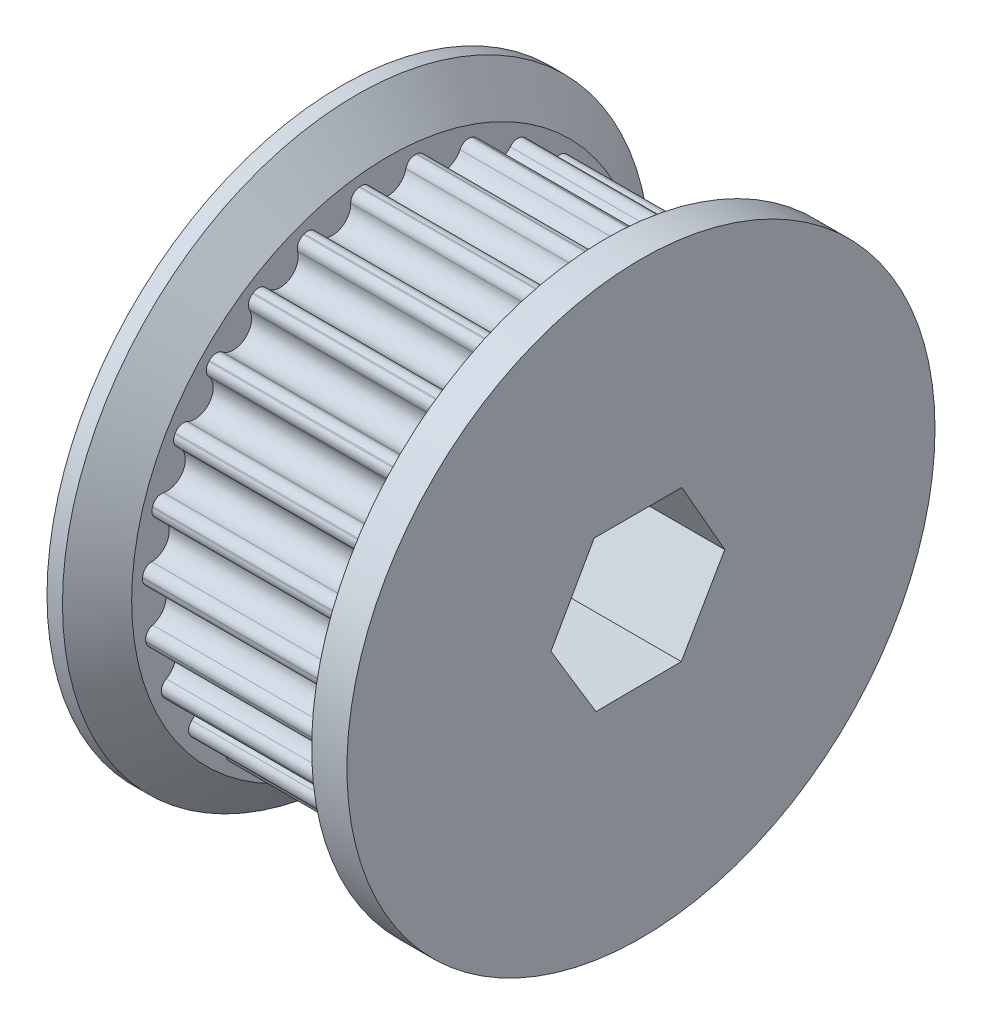
from build123d import *

# Parameters (mm, degrees)
SKETCH1_R                = 20.915
BOSS_EXTRUDE1_DEPTH      = 18.5
CUT_EXTRUDE6_START       = -43
CUT_EXTRUDE6_DEPTH       = 43
FILLET4_R                = 0.8
CIRPATTERN1_COUNT        = 27
FILLET4_OF_CIRPATTERN1_R = 0.8
SKETCH10_R               = 25
BOSS_EXTRUDE7_DEPTH      = 3
BOSS_EXTRUDE8_START      = 4
SKETCH11_R               = 25
BOSS_EXTRUDE8_DEPTH      = 4
CHAMFER1_SIZE            = 3.2
CHAMFER1_SIZE2           = 2.68511882
CUT_EXTRUDE5_DEPTH       = 42.379342793
CUT_EXTRUDE5_DEPTH_BACK  = 42.379342793


with BuildPart() as part:
    # Sketch1 → Boss-Extrude1 (new body)
    with BuildSketch(Plane(origin=(0, 0, 0), x_dir=(0, 0, -1), z_dir=(1, 0, 0))):
        Circle(SKETCH1_R)
    extrude(amount=BOSS_EXTRUDE1_DEPTH)

    # Sketch8 → Cut-Extrude6 (cut)
    with BuildSketch(Plane(origin=(18.5, 0, 0), x_dir=(0, 0, -1), z_dir=(1, 0, 0)).offset(CUT_EXTRUDE6_START)):
        with BuildLine():
            ThreePointArc((-1.488261256, 20.861982251), (0, 18.915), (1.488261256, 20.861982251))
            ThreePointArc((1.488261256, 20.861982251), (0, 20.915), (-1.488261256, 20.861982251))
        make_face()
    cut_extrude6 = extrude(amount=CUT_EXTRUDE6_DEPTH, mode=Mode.SUBTRACT)

    # Fillet4
    fillet4_edges = [part.edges().sort_by_distance(p)[0] for p in [
        (9.25, 20.861982251, -1.488261256),
        (9.25, 20.861982251, 1.488261256),
    ]]
    fillet(fillet4_edges, radius=FILLET4_R)

    # CirPattern1: Cut-Extrude6 ×27 about axis
    cirpattern1_axis = Axis((18.5, 0, 0), (-1, 0, 0))
    for i in range(1, CIRPATTERN1_COUNT):
        add(cut_extrude6.rotate(cirpattern1_axis, i * 360 / CIRPATTERN1_COUNT), mode=Mode.SUBTRACT)

    # Fillet4 of CirPattern1
    fillet4_of_cirpattern1_edges = [part.edges().sort_by_distance(p)[0] for p in [
        (9.25, 19.956428154, -6.259249183),
        (9.25, 20.642861485, -3.362959221),
        (9.25, 17.97501785, -10.692799367),
        (9.25, 19.310878713, -8.032881696),
        (9.25, 15.02456968, -14.549897969),
        (9.25, 16.937841471, -12.269749439),
        (9.25, 11.264143071, -17.622607806),
        (9.25, 13.651680811, -15.845151815),
        (9.25, 6.896463593, -19.745278294),
        (9.25, 9.629554505, -18.566337954),
        (9.25, 2.156993977, -20.803475719),
        (9.25, 5.088296424, -20.286608009),
        (9.25, -2.698759742, -20.740152383),
        (9.25, 0.272726965, -20.913221775),
        (9.25, -7.409022625, -19.558722063),
        (9.25, -4.557545276, -20.412398342),
        (9.25, -11.719863181, -17.322875975),
        (9.25, -9.14211907, -18.81113723),
        (9.25, -15.398882878, -14.153149158),
        (9.25, -13.23383886, -16.195762842),
        (9.25, -18.247744814, -10.220422408),
        (9.25, -16.612118971, -12.707270687),
        (9.25, -20.112866104, -5.73671004),
        (9.25, -19.094835448, -8.533726279),
        (9.25, -20.893697576, -0.943730148),
        (9.25, -20.548144404, -3.90012648),
        (9.25, -20.548144404, 3.90012648),
        (9.25, -20.893697576, 0.943730148),
        (9.25, -19.094835448, 8.533726279),
        (9.25, -20.112866104, 5.73671004),
        (9.25, -16.612118971, 12.707270687),
        (9.25, -18.247744814, 10.220422408),
        (9.25, -13.23383886, 16.195762842),
        (9.25, -15.398882878, 14.153149158),
        (9.25, -9.14211907, 18.81113723),
        (9.25, -11.719863181, 17.322875975),
        (9.25, -4.557545276, 20.412398342),
        (9.25, -7.409022625, 19.558722063),
        (9.25, 0.272726965, 20.913221775),
        (9.25, -2.698759742, 20.740152383),
        (9.25, 5.088296424, 20.286608009),
        (9.25, 2.156993977, 20.803475719),
        (9.25, 9.629554505, 18.566337954),
        (9.25, 6.896463593, 19.745278294),
        (9.25, 13.651680811, 15.845151815),
        (9.25, 11.264143071, 17.622607806),
        (9.25, 16.937841471, 12.269749439),
        (9.25, 15.02456968, 14.549897969),
        (9.25, 19.310878713, 8.032881696),
        (9.25, 17.97501785, 10.692799367),
        (9.25, 20.642861485, 3.362959221),
        (9.25, 19.956428154, 6.259249183),
    ]]
    fillet(fillet4_of_cirpattern1_edges, radius=FILLET4_OF_CIRPATTERN1_R)

    # Sketch10 → Boss-Extrude7 (add)
    with BuildSketch(Plane(origin=(18.5, 0, 0), x_dir=(0, 0, -1), z_dir=(1, 0, 0))):
        Circle(SKETCH10_R)
    extrude(amount=BOSS_EXTRUDE7_DEPTH)

    # Sketch11 → Boss-Extrude8 (add)
    with BuildSketch(Plane.ZY.offset(BOSS_EXTRUDE8_START)):
        Circle(SKETCH11_R)
    extrude(amount=-BOSS_EXTRUDE8_DEPTH)

    # Chamfer1
    chamfer1_edges = [part.edges().sort_by_distance(p)[0] for p in [
        (0, 0, -25),
    ]]
    chamfer1_side = [part.faces().sort_by_distance(p)[0] for p in [
        (0, 0, -24.292893216),
    ]]
    chamfer(chamfer1_edges, length=CHAMFER1_SIZE, length2=CHAMFER1_SIZE2, reference=chamfer1_side[0])

    # Sketch9 → Cut-Extrude5 (cut, two sides: drawn at the far end of the back side and taken through both)
    with BuildSketch(Plane.ZY.offset(-CUT_EXTRUDE5_DEPTH_BACK)):
        Polygon((-3.471061286, 6.444457654), (-7.125456531, 0.043657654), (-3.429837967, -6.357142346), (3.826782025, -6.409720657), (7.655941161, -0.063516257), (3.981752634, 6.444457654), align=None)
    extrude(amount=CUT_EXTRUDE5_DEPTH + CUT_EXTRUDE5_DEPTH_BACK, mode=Mode.SUBTRACT)


solid = part.part
